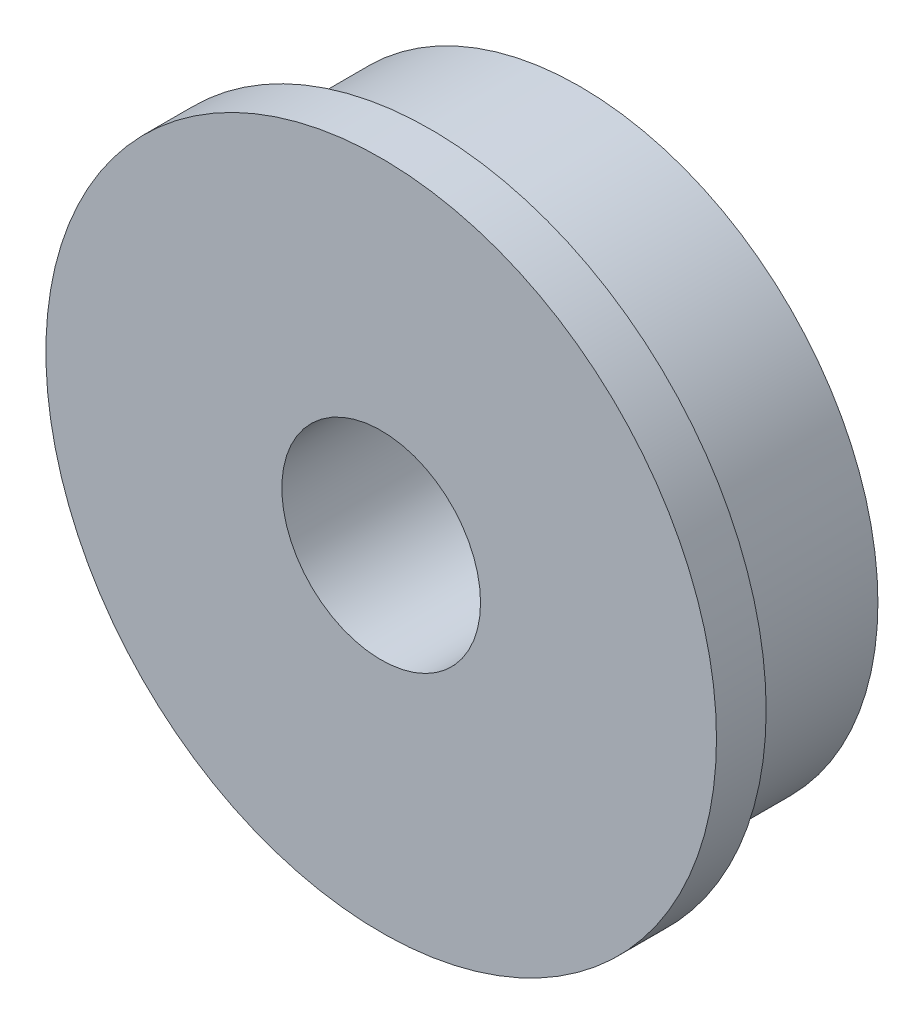
from build123d import *

# Parameters (mm, degrees)
SKETCH1_R           = 6
SKETCH1_R_2         = 2
BOSS_EXTRUDE1_DEPTH = 3
SKETCH2_R           = 6.75
SKETCH2_R_2         = 2
BOSS_EXTRUDE2_DEPTH = 1
FILLET1_SIZE        = 0.1
FILLET1_SIZE_2      = 0.01


with BuildPart() as part:
    # Sketch1 → Boss-Extrude1 (new body)
    with BuildSketch(Plane.XY):
        Circle(SKETCH1_R)
        Circle(SKETCH1_R_2, mode=Mode.SUBTRACT)
    extrude(amount=BOSS_EXTRUDE1_DEPTH)

    # Sketch2 → Boss-Extrude2 (add)
    with BuildSketch(Plane.XY.offset(3)):
        Circle(SKETCH2_R)
        Circle(SKETCH2_R_2, mode=Mode.SUBTRACT)
    extrude(amount=BOSS_EXTRUDE2_DEPTH)

    # Fillet1
    # an asymmetric fillet: 0.1, 0.01 mm, written as the material it adds along each edge
    with BuildSketch(Plane(origin=(0, 0, 3), x_dir=(1, 0, 0), z_dir=(0, -1, 0))) as fillet1_piece_1:
        with BuildLine():
            Bezier((6, -FILLET1_SIZE), (6, 0), (6 + FILLET1_SIZE_2, 0), weights=[1, 0.707106781, 1])
            Line((6 + FILLET1_SIZE_2, 0), (6, 0))
            Line((6, 0), (6, -FILLET1_SIZE))
        make_face()
    revolve(axis=Axis((0, 0, 3), (0, 0, 1)))


solid = part.part
